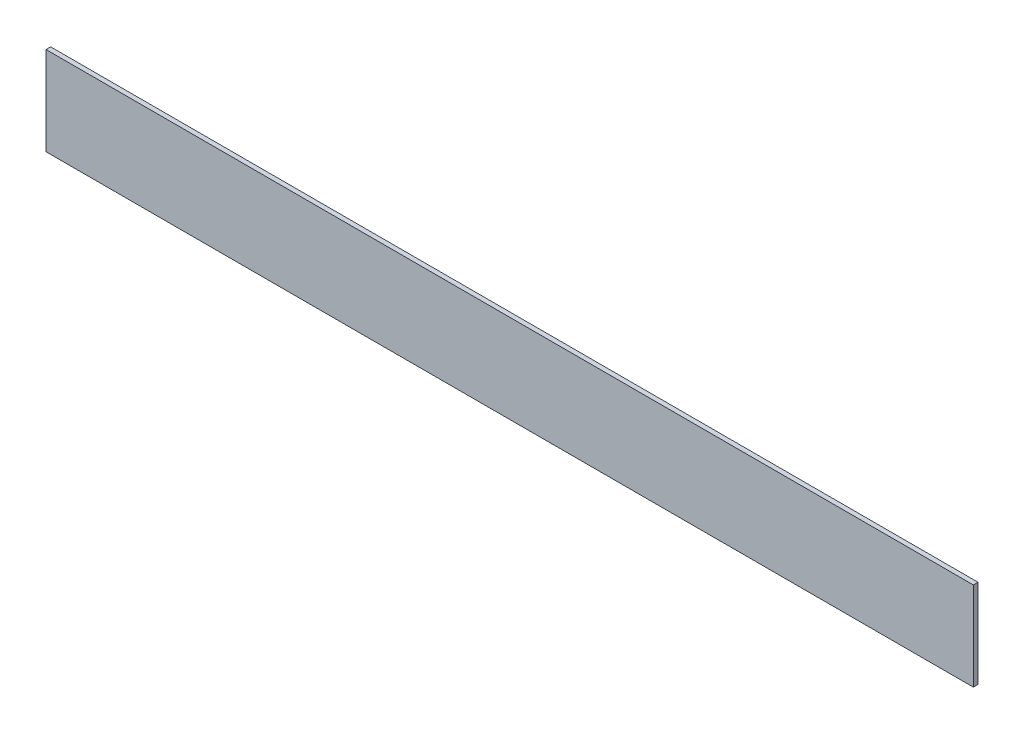
from build123d import *

# Parameters (mm, degrees)
IZIM1_W            = 995
IZIM1_H            = 95
TABAN_FLAN_1_DEPTH = 5


# Sheet-metal steps are written as plain solids
with BuildPart() as part:
    # Çizim1 → Taban-Flanş1 (new body)
    with BuildSketch(Plane.XY):
        with Locations((497.5, -47.5)):
            Rectangle(IZIM1_W, IZIM1_H)
    extrude(amount=-TABAN_FLAN_1_DEPTH)


solid = part.part
